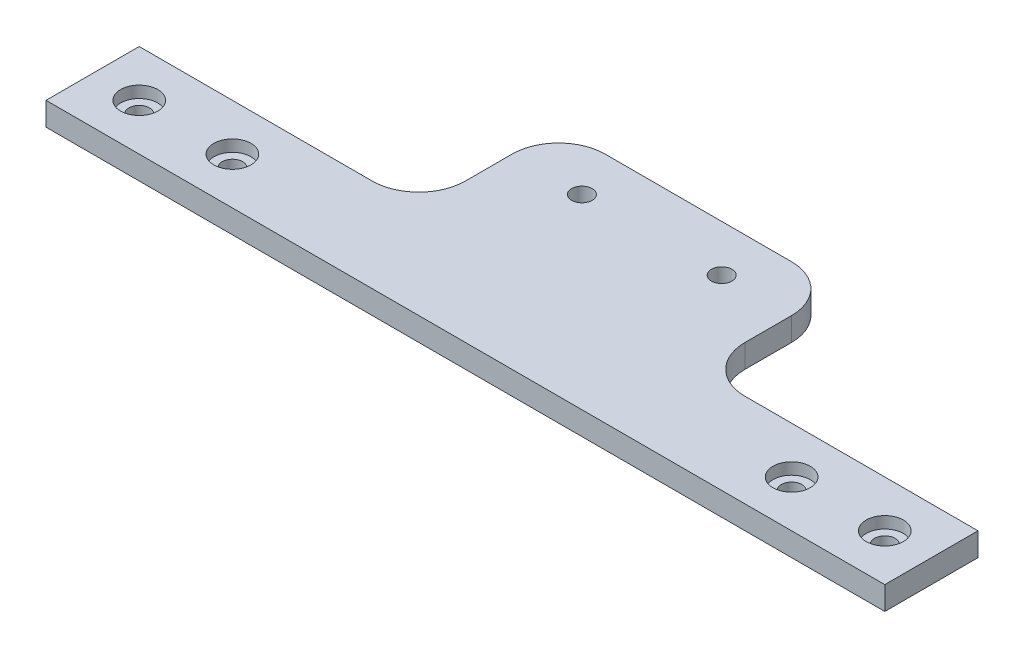
from build123d import *

# Parameters (mm, degrees)
SKETCH1_W           = 406.4
SKETCH1_H           = 25.4
SKETCH1_W_2         = 76.2
SKETCH1_H_2         = 38.1
BOSS_EXTRUDE1_DEPTH = 6.35
SKETCH3_R           = 2.794
CUT_EXTRUDE2_DEPTH  = 6.35
FILLET1_R           = 12.7
SKETCH4_R           = 2.794
CUT_EXTRUDE3_DEPTH  = 19.05
SKETCH5_R           = 5.08
CUT_EXTRUDE4_DEPTH  = 3.175
SKETCH6_W           = 88.9
SKETCH6_H           = 25.4
CUT_EXTRUDE5_DEPTH  = 6.35


with BuildPart() as part:
    # Sketch1 → Boss-Extrude1 (new body)
    with BuildSketch(Plane(origin=(0, 0, 0), x_dir=(1, 0, 0), z_dir=(0, 1, 0))):
        with Locations((203.2, 12.7)):
            Rectangle(SKETCH1_W, SKETCH1_H)
        with Locations((203.2, 44.45)):
            Rectangle(SKETCH1_W_2, SKETCH1_H_2)
    extrude(amount=BOSS_EXTRUDE1_DEPTH)

    # Sketch3 → Cut-Extrude2 (cut)
    with BuildSketch(Plane(origin=(0, 6.35, 0), x_dir=(1, 0, 0), z_dir=(0, 1, 0))):
        with Locations(Location((222.25, 50.8, 0), (0, 0, 270))):
            Circle(SKETCH3_R)
        with Locations(Location((184.15, 50.8, 0), (0, 0, 270))):
            Circle(SKETCH3_R)
    extrude(amount=-CUT_EXTRUDE2_DEPTH, mode=Mode.SUBTRACT)

    # Fillet1
    fillet1_edges = [part.edges().sort_by_distance(p)[0] for p in [
        (406.4, 3.175, 0),
        (406.4, 3.175, -25.4),
        (0, 3.175, 0),
        (0, 3.175, -25.4),
        (165.1, 3.175, -25.4),
        (241.3, 3.175, -25.4),
        (241.3, 3.175, -63.5),
        (165.1, 3.175, -63.5),
    ]]
    fillet(fillet1_edges, radius=FILLET1_R - 0.0001)  # a hair under: the kernel refuses the full size

    # Sketch4 → Cut-Extrude3 (cut)
    with BuildSketch(Plane(origin=(0, 6.35, 0), x_dir=(1, 0, 0), z_dir=(0, 1, 0))):
        with Locations(Location((279.4, 12.7, 0), (0, 0, 270))):
            Circle(SKETCH4_R)
        with Locations(Location((304.8, 12.7, 0), (0, 0, 270))):
            Circle(SKETCH4_R)
        with Locations(Location((127, 12.7, 0), (0, 0, 270))):
            Circle(SKETCH4_R)
        with Locations(Location((101.6, 12.7, 0), (0, 0, 270))):
            Circle(SKETCH4_R)
    extrude(amount=-CUT_EXTRUDE3_DEPTH, mode=Mode.SUBTRACT)

    # Sketch5 → Cut-Extrude4 (cut)
    with BuildSketch(Plane(origin=(0, 6.35, 0), x_dir=(1, 0, 0), z_dir=(0, 1, 0))):
        with Locations(Location((101.6, 12.7, 0), (0, 0, 270))):
            Circle(SKETCH5_R)
        with Locations(Location((127, 12.7, 0), (0, 0, 270))):
            Circle(SKETCH5_R)
        with Locations(Location((279.4, 12.7, 0), (0, 0, 270))):
            Circle(SKETCH5_R)
        with Locations(Location((304.8, 12.7, 0), (0, 0, 270))):
            Circle(SKETCH5_R)
    extrude(amount=-CUT_EXTRUDE4_DEPTH, mode=Mode.SUBTRACT)

    # Sketch6 → Cut-Extrude5 (cut)
    with BuildSketch(Plane(origin=(0, 6.35, 0), x_dir=(1, 0, 0), z_dir=(0, 1, 0))):
        with Locations((44.45, 12.7)):
            Rectangle(SKETCH6_W, SKETCH6_H)
        with Locations((361.95, 12.7)):
            Rectangle(SKETCH6_W, SKETCH6_H)
    extrude(amount=-CUT_EXTRUDE5_DEPTH, mode=Mode.SUBTRACT)


solid = part.part
